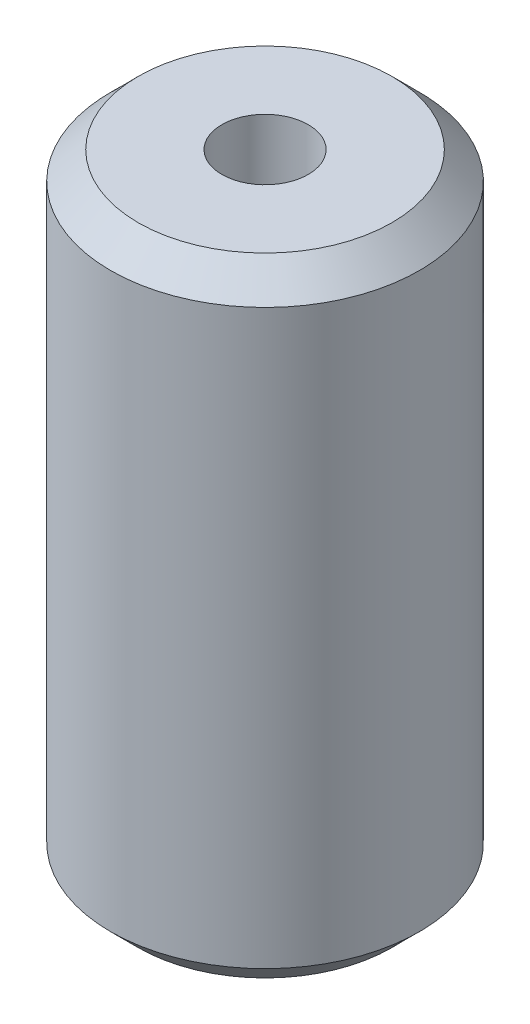
from build123d import *

# Parameters (mm, degrees)
SKETCH1_R           = 20
BOSS_EXTRUDE1_DEPTH = 81.319626872
SKETCH2_R           = 5.593494157
CUT_EXTRUDE1_DEPTH  = 87.098093559
CHAMFER1_SIZE       = 3.574574908


with BuildPart() as part:
    # Sketch1 → Boss-Extrude1 (new body)
    with BuildSketch(Plane(origin=(0, 0, 0), x_dir=(1, 0, 0), z_dir=(0, 1, 0))):
        Circle(SKETCH1_R)
    extrude(amount=BOSS_EXTRUDE1_DEPTH)

    # Sketch2 → Cut-Extrude1 (cut, through all)
    with BuildSketch(Plane(origin=(0, 0, 0), x_dir=(1, 0, 0), z_dir=(0, 1, 0))):
        Circle(SKETCH2_R)
    extrude(amount=CUT_EXTRUDE1_DEPTH, mode=Mode.SUBTRACT)

    # Chamfer1
    chamfer1_edges = [part.edges().sort_by_distance(p)[0] for p in [
        (-20, 81.319626872, 0),
        (-20, 0, 0),
    ]]
    chamfer(chamfer1_edges, length=CHAMFER1_SIZE)


solid = part.part
